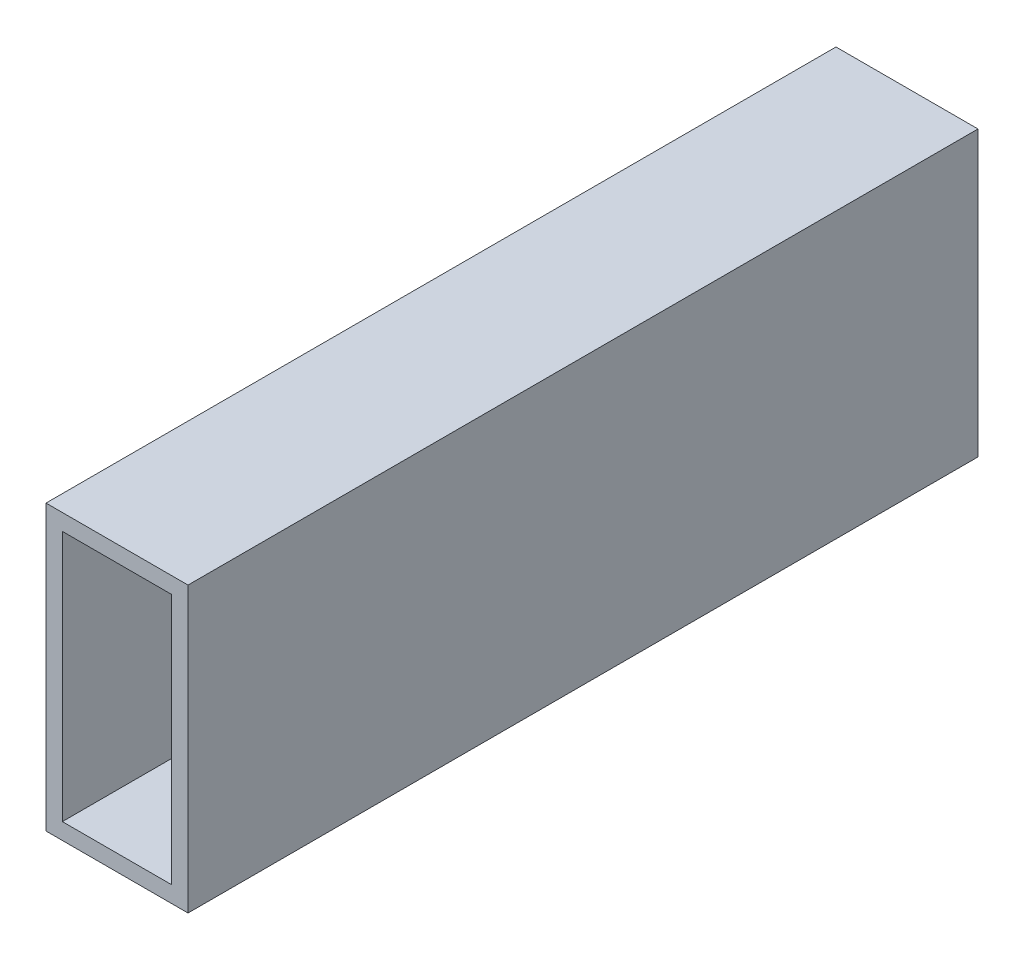
from build123d import *

# Parameters (mm, degrees)
SKETCH1_W           = 25.4
SKETCH1_H           = 50.8
SKETCH1_W_2         = 19.558
SKETCH1_H_2         = 44.958
BOSS_EXTRUDE1_DEPTH = 141.2875


with BuildPart() as part:
    # Sketch1 → Boss-Extrude1 (new body)
    with BuildSketch(Plane.XY):
        Rectangle(SKETCH1_W, SKETCH1_H)
        Rectangle(SKETCH1_W_2, SKETCH1_H_2, mode=Mode.SUBTRACT)
    extrude(amount=BOSS_EXTRUDE1_DEPTH)


solid = part.part
